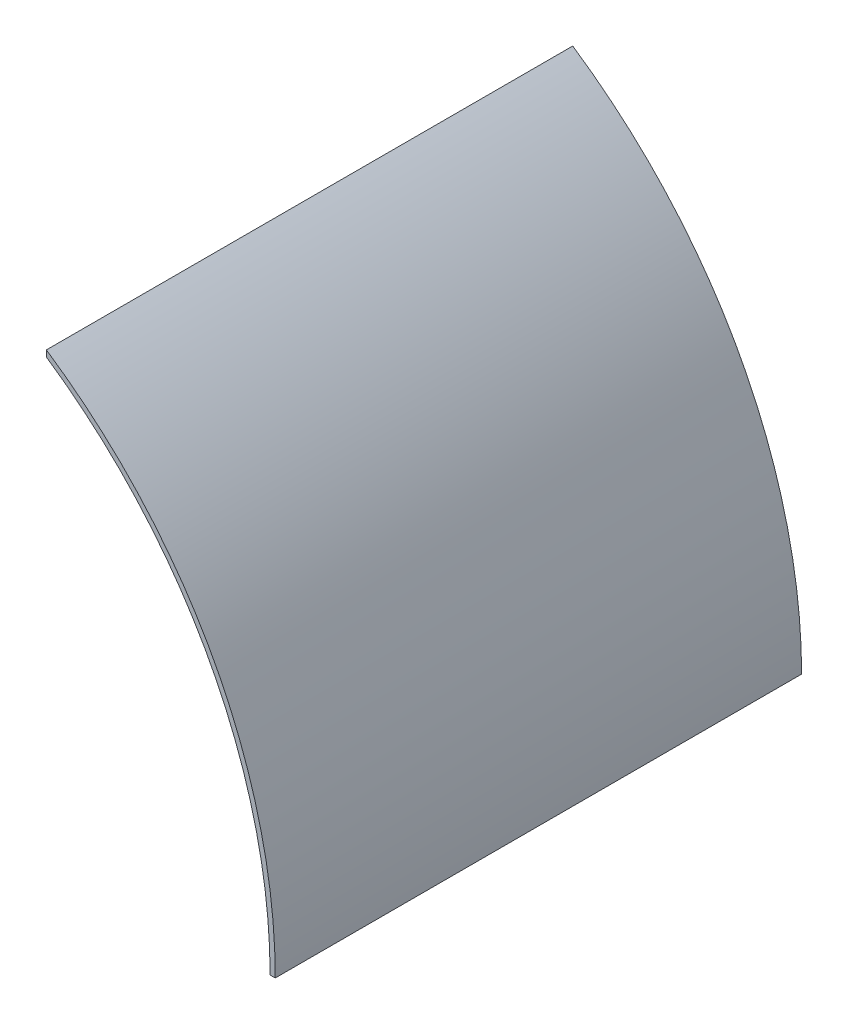
from build123d import *

# Parameters (mm, degrees)
INNER_RING_RIGHT_SIDE_DEPTH = 155


with BuildPart() as part:
    # Sketch2 → Inner Ring - Right Side (new body)
    with BuildSketch(Plane.XY):
        with BuildLine():
            Line((85, 126.494110535), (85, 124.659938641))
            ThreePointArc((85, 124.659938641), (133.397886231, 70.498966311), (150.88108, 0))
            Line((150.88108, 0), (152.4, 0))
            ThreePointArc((152.4, 0), (134.498624528, 71.665054245), (85, 126.494110535))
        make_face()
    extrude(amount=INNER_RING_RIGHT_SIDE_DEPTH)


solid = part.part
